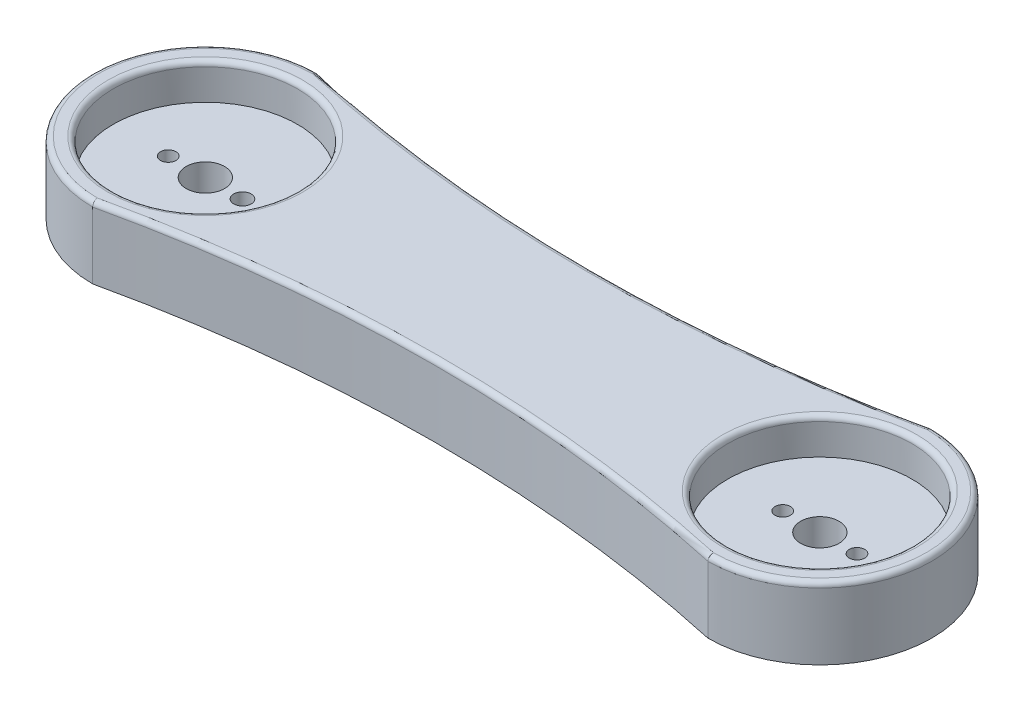
from build123d import *

# Parameters (mm, degrees)
SALIENTE_EXTRUIR7_DEPTH = 14
CROQUIS4_R              = 18
CORTAR_EXTRUIR1_DEPTH   = 7
CROQUIS5_R              = 3.75
CROQUIS5_R_2            = 1.5
CROQUIS5_R_3            = 1.702426791
CORTAR_EXTRUIR3_DEPTH   = 144.864519601
CROQUIS6_R              = 3.75
CROQUIS6_R_2            = 1.5
CORTAR_EXTRUIR4_DEPTH   = 144.864519601
REDONDEO2_R             = 1


with BuildPart() as part:
    # Croquis1 → Saliente-Extruir7 (new body)
    with BuildSketch(Plane(origin=(0, 0, 0), x_dir=(1, 0, 0), z_dir=(0, 1, 0))):
        with BuildLine():
            ThreePointArc((-120, 22), (-142, 0), (-120, -22))
            ThreePointArc((-120, -22), (-60.008802525, -15.348556021), (0, -21.839249444))
            ThreePointArc((0, -21.839249444), (21.839249444, 0), (0, 21.839249444))
            ThreePointArc((0, 21.839249444), (-60.008802533, 15.348549982), (-120, 22))
        make_face()
    extrude(amount=SALIENTE_EXTRUIR7_DEPTH)

    # Croquis4 → Cortar-Extruir1 (cut)
    with BuildSketch(Plane(origin=(0, 14, 0), x_dir=(1, 0, 0), z_dir=(0, 1, 0))):
        with Locations(Location((-120, 0, 0), (0, 0, 270))):
            Circle(CROQUIS4_R)
        with Locations(Location((0, 0, 0), (0, 0, 270))):
            Circle(CROQUIS4_R)
    extrude(amount=-CORTAR_EXTRUIR1_DEPTH, mode=Mode.SUBTRACT)

    # Croquis5 → Cortar-Extruir3 (cut, through all)
    with BuildSketch(Plane(origin=(0, 7, 0), x_dir=(1, 0, 0), z_dir=(0, 1, 0))):
        with Locations(Location((-120, 0, 0), (0, 0, 270))):
            Circle(CROQUIS5_R)
        with Locations(Location((-127.25, 0, 0), (0, 0, 270))):
            Circle(CROQUIS5_R_2)
        with Locations(Location((-112.75, 0, 0), (0, 0, 270))):
            Circle(CROQUIS5_R_3)
    extrude(amount=-CORTAR_EXTRUIR3_DEPTH, mode=Mode.SUBTRACT)

    # Croquis6 → Cortar-Extruir4 (cut, through all)
    with BuildSketch(Plane(origin=(0, 7, 0), x_dir=(1, 0, 0), z_dir=(0, 1, 0))):
        with Locations(Location((0, 0, 0), (0, 0, 270))):
            Circle(CROQUIS6_R)
        with Locations(Location((7.25, 0, 0), (0, 0, 270))):
            Circle(CROQUIS6_R_2)
        with Locations(Location((-7.25, 0, 0), (0, 0, 270))):
            Circle(CROQUIS6_R_2)
    extrude(amount=-CORTAR_EXTRUIR4_DEPTH, mode=Mode.SUBTRACT)

    # Redondeo2
    # the kernel refuses this fillet: 1 mm, written as the material it takes off along each edge
    with BuildSketch(Plane(origin=(-59.637450549, 14, 292.562134942), x_dir=(-0.226540467768197, 0, -0.9740017538297179), z_dir=(-0.9740017538297179, 0, 0.226540467768197))) as redondeo2_piece_1:
        with BuildLine():
            CenterArc((277.21382765 + REDONDEO2_R, REDONDEO2_R), REDONDEO2_R, 180, 90)
            Line((277.21382765 + REDONDEO2_R, 0), (277.21382765, 0))
            Line((277.21382765, 0), (277.21382765, REDONDEO2_R))
        make_face()
    revolve(axis=Axis((-59.637450549, 14, 292.562134942), (0, -1, 0)), revolution_arc=26.03345413, mode=Mode.SUBTRACT)
    with BuildSketch(Plane(origin=(-120, 14, 0), x_dir=(0, 0, 1), z_dir=(-1, 0, 0))) as redondeo2_piece_2:
        with BuildLine():
            CenterArc((18 + REDONDEO2_R, -REDONDEO2_R), REDONDEO2_R, 90, 90)
            Line((18, -REDONDEO2_R), (18, 0))
            Line((18, 0), (18 + REDONDEO2_R, 0))
        make_face()
    revolve(axis=Axis((-120, 14, 0), (0, 1, 0)), mode=Mode.SUBTRACT)
    with BuildSketch(Plane(origin=(0, 14, 0), x_dir=(-0.11440584030720254, 0, 0.993434096306143), z_dir=(-0.993434096306143, 0, -0.11440584030720254))) as redondeo2_piece_3:
        with BuildLine():
            CenterArc((21.839249444 - REDONDEO2_R, -REDONDEO2_R), REDONDEO2_R, 0, 90)
            Line((21.839249444 - REDONDEO2_R, 0), (21.839249444, 0))
            Line((21.839249444, 0), (21.839249444, -REDONDEO2_R))
        make_face()
    revolve(axis=Axis((0, 14, 0), (0, 1, 0)), revolution_arc=193.138712049, mode=Mode.SUBTRACT)
    with BuildSketch(Plane(origin=(0, 14, 0), x_dir=(0, 0, 1), z_dir=(-1, 0, 0))) as redondeo2_piece_4:
        with BuildLine():
            CenterArc((18 + REDONDEO2_R, -REDONDEO2_R), REDONDEO2_R, 90, 90)
            Line((18, -REDONDEO2_R), (18, 0))
            Line((18, 0), (18 + REDONDEO2_R, 0))
        make_face()
    revolve(axis=Axis((0, 14, 0), (0, 1, 0)), mode=Mode.SUBTRACT)
    with BuildSketch(Plane(origin=(-59.637450891, 14, -292.561880174), x_dir=(0.22393033908793564, 0, 0.9746051524776391), z_dir=(0.9746051524776391, 0, -0.22393033908793564))) as redondeo2_piece_5:
        with BuildLine():
            CenterArc((277.213578921 + REDONDEO2_R, REDONDEO2_R), REDONDEO2_R, 180, 90)
            Line((277.213578921 + REDONDEO2_R, 0), (277.213578921, 0))
            Line((277.213578921, 0), (277.213578921, REDONDEO2_R))
        make_face()
    revolve(axis=Axis((-59.637450891, 14, -292.561880174), (0, -1, 0)), revolution_arc=26.033477851, mode=Mode.SUBTRACT)
    with BuildSketch(Plane(origin=(-120, 14, 0), x_dir=(0.11357352107267756, 0, -0.9935295945824433), z_dir=(0.9935295945824433, 0, 0.11357352107267756))) as redondeo2_piece_6:
        with BuildLine():
            CenterArc((22 - REDONDEO2_R, -REDONDEO2_R), REDONDEO2_R, 0, 90)
            Line((22, -REDONDEO2_R), (22, 0))
            Line((22, 0), (22 - REDONDEO2_R, 0))
        make_face()
    revolve(axis=Axis((-120, 14, 0), (0, 1, 0)), revolution_arc=193.042709536, mode=Mode.SUBTRACT)


solid = part.part
